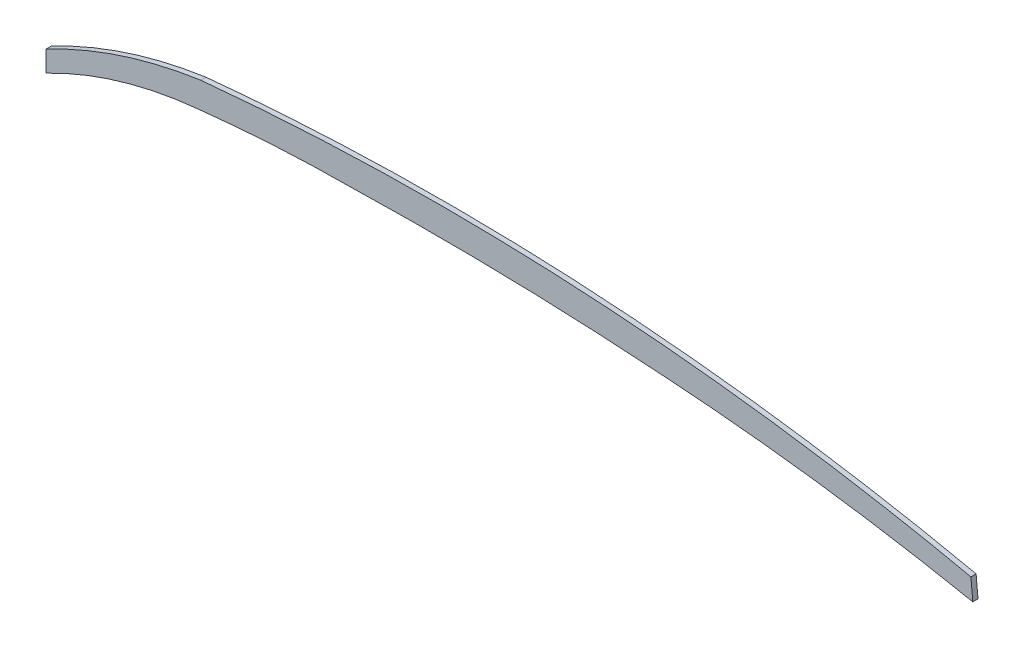
from build123d import *

# Parameters (mm, degrees)
BOSS_EXTRUDE1_DEPTH = 1.5875


with BuildPart() as part:
    # Sketch1 → Boss-Extrude1 (new, symmetric)
    with BuildSketch(Plane.XY):
        with BuildLine():
            Line((0, 98.650251409), (0, 85.942482804))
            ThreePointArc((0, 85.942482804), (44.883725347, 104.075777355), (92.3925, 113.364561093))
            ThreePointArc((92.3925, 113.364561093), (139.073495573, 117.280297245), (185.895946704, 118.731643998))
            ThreePointArc((185.895946704, 118.731643998), (279.546572247, 118.92726657), (373.101055052, 114.68030529))
            ThreePointArc((373.101055052, 114.68030529), (470.024153779, 105.277769076), (566.085246422, 89.31652744))
            Line((566.085246422, 89.31652744), (564.932089986, 101.967475673))
            add(Edge.make_bspline(
                [(564.932089986, 101.967475673), (526.305455218, 110.35905311), (487.405693808, 117.234860687), (438.439550099, 123.934721128), (428.624759847, 125.180263294), (408.998984047, 127.476820047), (399.18472115, 128.528373058), (369.737829992, 131.394440576), (350.101100844, 132.920474645), (291.174630327, 136.353130053), (251.868630305, 137.116022476), (173.213311456, 135.594508668), (133.863993721, 133.310179259), (94.492645692, 129.476109839)],
                knots=[0, 0, 0, 0, 0.25, 0.25, 0.3125, 0.3125, 0.375, 0.375, 0.5, 0.5, 0.75, 0.75, 1, 1, 1, 1], degree=3))
            ThreePointArc((94.492645692, 129.476109839), (45.925545315, 118.111851759), (0, 98.650251409))
        make_face()
    extrude(amount=BOSS_EXTRUDE1_DEPTH, both=True)


solid = part.part
